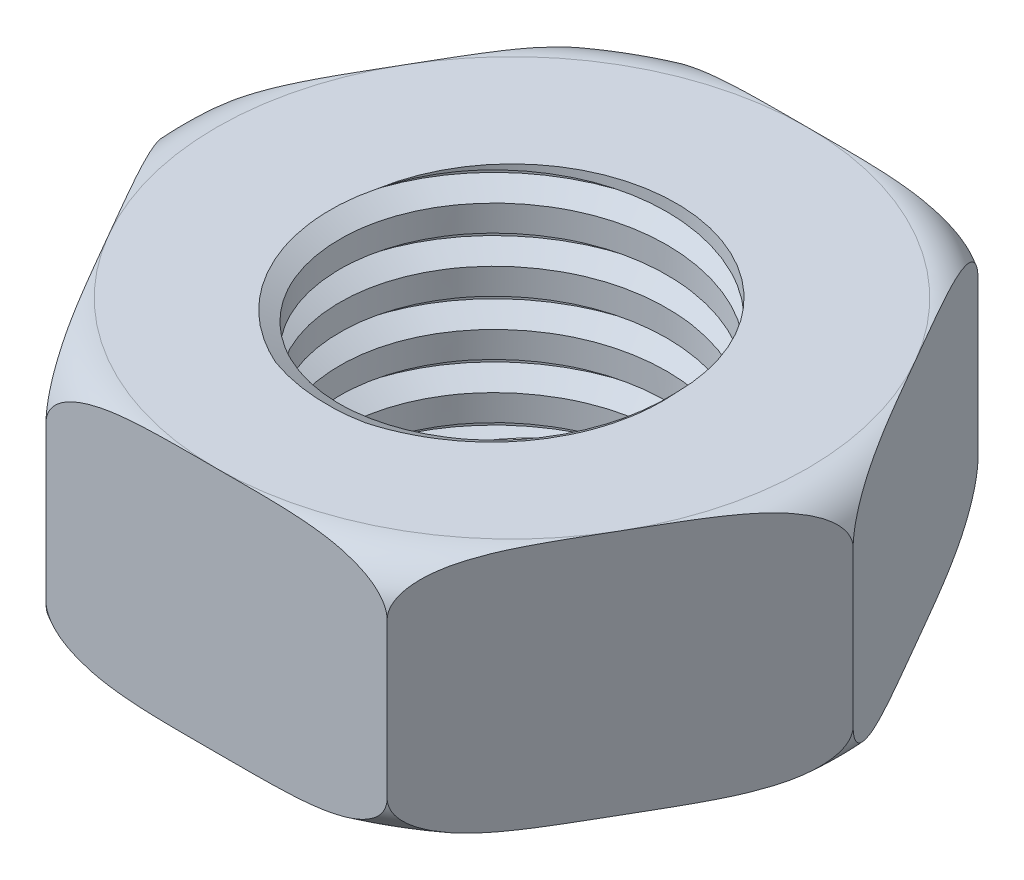
from build123d import *

# Parameters (mm, degrees)
SKETCH1_R           = 1.5
BOSS_EXTRUDE1_DEPTH = 1.125
THREAD1_PITCH       = 0.5


with BuildPart() as part:
    # Sketch1 → Boss-Extrude1 (new, symmetric)
    with BuildSketch(Plane(origin=(0, 0, 0), x_dir=(1, 0, 0), z_dir=(0, 1, 0))):
        Polygon((3.117691454, 0), (1.558845727, 2.7), (-1.558845727, 2.7), (-3.117691454, 0), (-1.558845727, -2.7), (1.558845727, -2.7), align=None)
        with Locations(Location((0, 0, 0), (0, 0, 270))):
            Circle(SKETCH1_R, mode=Mode.SUBTRACT)
    extrude(amount=BOSS_EXTRUDE1_DEPTH, both=True)

    # Sketch2 → Cut-Revolve1 (revolve, cut)
    with BuildSketch(Plane.XY):
        with BuildLine():
            Line((3.117691454, 1.125), (3.117691454, 0.707308546))
            ThreePointArc((3.117691454, 0.707308546), (2.995352459, 1.002661006), (2.7, 1.125))
            Line((2.7, 1.125), (3.117691454, 1.125))
        make_face()
        with BuildLine():
            Line((2.7, -1.125), (3.117691454, -1.125))
            Line((3.117691454, -1.125), (3.117691454, -0.707308546))
            ThreePointArc((3.117691454, -0.707308546), (2.995352459, -1.002661006), (2.7, -1.125))
        make_face()
    revolve(axis=Axis((0, 1.125, 0), (0, -1, 0)), mode=Mode.SUBTRACT)

    # Thread1: arcs per turn and ends read off the stored shape
    # Thread1: the profile of Thread Profile1 profile screwed along a right-hand helix through 20 turns, 6 arcs to a turn; built about Z, then put on its axis
    thread1_z = Axis((0, 0, 0), (0, 0, 1))
    thread1_corners = [(1.4997, 0, -10.000173205), (1.689443056, 0, -9.890625), (1.689443056, 0, -9.846875), (1.4997, 0, -9.737326796)]
    with BuildLine(mode=Mode.PRIVATE) as thread1_profile:
        Line(thread1_corners[0], thread1_corners[1])
        Line(thread1_corners[1], thread1_corners[2])
        Line(thread1_corners[2], thread1_corners[3])
        Line(thread1_corners[3], thread1_corners[0])
    thread1_cap = Face(thread1_profile.wire())
    thread1_turn_angles = [0, 30, 60, 90, 120, 150, 180, 210, 240, 270, 300, 330, 360]
    thread1_turn_weights = [1, 0.8660254037844387, 1, 0.8660254037844387, 1, 0.8660254037844387, 1, 0.8660254037844387, 1, 0.8660254037844387, 1, 0.8660254037844387, 1]
    thread1_turn_rails = [Edge.make_bspline([Vector(p[0], p[1], 0).rotate(thread1_z, thread1_turn_angles[k]) / thread1_turn_weights[k] + Vector(0, 0, p[2] + THREAD1_PITCH * thread1_turn_angles[k] / 360) for k in range(13)], [0, 0, 0, 1, 1, 2, 2, 3, 3, 4, 4, 5, 5, 6, 6, 6], 2, thread1_turn_weights) for p in thread1_corners]
    thread1_turn_sides = [Face.make_surface_from_curves(thread1_turn_rails[p[0]], thread1_turn_rails[p[1]]) for p in [(0, 1), (1, 2), (2, 3), (3, 0)]]
    thread1 = Plane(origin=(0, 1.125, 0), x_dir=(1, 0, 0), z_dir=(0, 1, 0)) * Solid(Shell([*[p.moved(Location((0, 0, THREAD1_PITCH * i))) for i in range(20) for p in thread1_turn_sides], thread1_cap, thread1_cap.rotate(thread1_z, 7200).moved(Location((0, 0, THREAD1_PITCH * 7200 / 360)))]))
    add(thread1, mode=Mode.SUBTRACT)


solid = part.part
